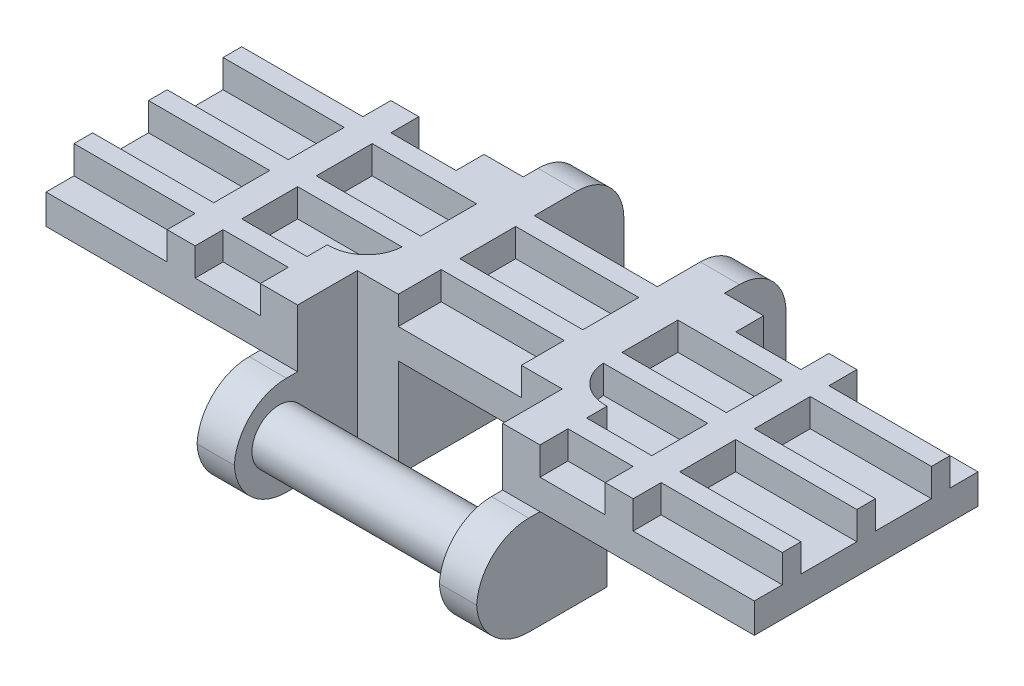
from build123d import *

# Parameters (mm, degrees)
SKETCH_1_W               = 38
SKETCH_1_H               = 12
EXTRUDE_1_DEPTH          = 1.6
EXTRUDE_START            = 1.6
SKETCH_1_3_W             = 38
SKETCH_1_3_H             = 1
SKETCH_1_3_W_2           = 1.5
SKETCH_1_3_H_2           = 12
EXTRUDE_2_DEPTH          = 1.5
EXTRUDE_START_2          = 3.1
EXTRUDE_3_DEPTH          = 8.4
SKETCH_2_4_W             = 2.1
SKETCH_2_4_H             = 1.5
EXTRUDE_5_DEPTH          = 3.1
CUT_EXTRUDE_1_DEPTH      = 22.850629282
FILLET_1_R               = 3
EXTRUDE_4_REACH          = 28.771
SKETCH_3_R               = 1.45
CUT_EXTRUDE_2_DEPTH      = 27.771253239
CUT_EXTRUDE_2_DEPTH_BACK = 27.771253239
SKETCH_3_3_R             = 1.7
SKETCH_3_3_W             = 6.5
SKETCH_3_3_H             = 1.2
SKETCH_3_3_W_2           = 3.4
SKETCH_3_3_H_2           = 3.1
FILLET_2_R               = 2.8
FILLET_3_R               = 2.5
FILLET_4_R               = 1
FILLET_5_R               = 0.3
FILLET_6_R               = 2


with BuildPart() as part:
    # 草图1 → 凸台-拉伸1 (new body)
    with BuildSketch(Plane(origin=(0, 0, 0), x_dir=(1, 0, 0), z_dir=(0, 1, 0))):
        Rectangle(SKETCH_1_W, SKETCH_1_H)
    extrude(amount=EXTRUDE_1_DEPTH)

    # 草图1<3> → 凸台-拉伸2 (add)
    with BuildSketch(Plane(origin=(0, 0, 0), x_dir=(1, 0, 0), z_dir=(0, 1, 0)).offset(EXTRUDE_START)):
        with Locations((0, 4)):
            Rectangle(SKETCH_1_3_W, SKETCH_1_3_H)
        Rectangle(SKETCH_1_3_W, SKETCH_1_3_H)
        with Locations((0, -4)):
            Rectangle(SKETCH_1_3_W, SKETCH_1_3_H)
        with Locations((-11.75, 0)):
            Rectangle(SKETCH_1_3_W_2, SKETCH_1_3_H_2)
        with Locations((11.75, 0)):
            Rectangle(SKETCH_1_3_W_2, SKETCH_1_3_H_2)
    extrude(amount=EXTRUDE_2_DEPTH)

    # 草图2 → 凸台-拉伸3 (add)
    with BuildSketch(Plane(origin=(0, 0, 0), x_dir=(1, 0, 0), z_dir=(0, 1, 0)).offset(EXTRUDE_START_2)):
        Polygon((-3.3, 9.3), (-5.4, 9.3), (-5.4, -2.4), (-7.5, -2.4), (-7.5, -9.4), (-5.5, -9.4), (-5.5, -2.8), (-3.3, -2.8), align=None)
        Polygon((5.4, 9.3), (3.3, 9.3), (3.3, -2.8), (5.5, -2.8), (5.5, -9.4), (7.5, -9.4), (7.5, -2.4), (5.4, -2.4), align=None)
    extrude(amount=-EXTRUDE_3_DEPTH)

    # 草图2<4> → 凸台-拉伸5 (add)
    with BuildSketch(Plane(origin=(0, 0, 0), x_dir=(1, 0, 0), z_dir=(0, 1, 0))):
        with Locations((-6.45, 5.25)):
            Rectangle(SKETCH_2_4_W, SKETCH_2_4_H)
        with Locations((6.45, 5.25)):
            Rectangle(SKETCH_2_4_W, SKETCH_2_4_H)
    extrude(amount=EXTRUDE_5_DEPTH)

    # 草图2<3> → 切除-拉伸1 (cut, through all)
    with BuildSketch(Plane(origin=(0, 0, 0), x_dir=(1, 0, 0), z_dir=(0, 1, 0))):
        Polygon((0, -9.4), (0, -2.8), (-3.3, -2.8), (-5.4, -2.8), (-5.5, -2.8), (-5.5, -9.4), align=None)
        Polygon((3.3, -2.8), (0, -2.8), (0, -9.4), (5.5, -9.4), (5.5, -2.8), (5.4, -2.8), align=None)
    extrude(amount=CUT_EXTRUDE_1_DEPTH, mode=Mode.SUBTRACT)

    # 圆角1
    # the kernel refuses this fillet: 3 mm, written as the material it adds along each edge
    with BuildSketch(Plane(origin=(5.4, 7.154544011, 2.4), x_dir=(1, 0, 0), z_dir=(0, -1, 0))) as fillet_1_piece_1_section:
        with BuildLine():
            CenterArc((3, -2.861817604), FILLET_1_R, 107.457603124, 72.542396876)
            Line((0, -2.861817604), (0, 0))
            Line((0, 0), (2.1, 0))
        make_face()
    fillet_1_piece_1 = extrude(amount=12.454544011, mode=Mode.PRIVATE)
    fillet_1_piece_1 = split(fillet_1_piece_1, bisect_by=Plane(origin=(6.297598678, 1.6, 1.686657362), z_dir=(0, -1, 0)), keep=Keep.TOP, mode=Mode.PRIVATE)
    add(fillet_1_piece_1)
    with BuildSketch(Plane(origin=(-5.4, 0, 2.4), x_dir=(0, 0, -1), z_dir=(0, -1, 0))) as fillet_1_piece_2:
        with BuildLine():
            CenterArc((2.861817604, -3), FILLET_1_R, 90, 72.542396876)
            Line((0, -2.1), (0, 0))
            Line((0, 0), (2.861817604, 0))
        make_face()
    extrude(amount=5.3)

    # 草图3 → 凸台-拉伸4 (add, up to next)
    with BuildSketch(Plane(origin=(-5.5, 0, 0), x_dir=(0, 0, -1), z_dir=(1, 0, 0)), mode=Mode.PRIVATE) as extrude_4_sk1:
        with Locations((-7, -2.5)):
            Circle(SKETCH_3_R)
    extrude_4_tool1 = extrude(extrude_4_sk1.sketch, amount=EXTRUDE_4_REACH, mode=Mode.PRIVATE) - part.part
    add(extrude_4_tool1.solids().sort_by_distance((-5.5, -2.5, 7))[0])

    # 草图3<3> → 切除-拉伸2 (cut, two sides: drawn at the far end of the back side and taken through both)
    with BuildSketch(Plane(origin=(-5.5, 0, 0), x_dir=(0, 0, -1), z_dir=(1, 0, 0)).offset(-CUT_EXTRUDE_2_DEPTH_BACK)):
        with Locations((5.58, -2.5)):
            Circle(SKETCH_3_3_R)
        with Locations((6.05, -4.7)):
            Rectangle(SKETCH_3_3_W, SKETCH_3_3_H)
        with Locations((-7.7, 1.55)):
            Rectangle(SKETCH_3_3_W_2, SKETCH_3_3_H_2)
    extrude(amount=CUT_EXTRUDE_2_DEPTH + CUT_EXTRUDE_2_DEPTH_BACK, mode=Mode.SUBTRACT)

    # 圆角2
    # the kernel refuses this fillet: 2.8 mm, written as the material it takes off along each edge
    with BuildSketch(Plane(origin=(-1.5, 0, 9.4), x_dir=(0, 0, -1), z_dir=(1, 0, 0)), Plane(origin=(-14.5, 0, 9.4), x_dir=(0, 0, -1), z_dir=(1, 0, 0))) as fillet_2_piece_1:
        with BuildLine():
            CenterArc((FILLET_2_R, -FILLET_2_R), FILLET_2_R, 90, 90)
            Line((0, -FILLET_2_R), (0, 0))
            Line((0, 0), (FILLET_2_R, 0))
        make_face()
    extrude(amount=16, mode=Mode.SUBTRACT)
    with BuildSketch(Plane(origin=(-1.5, -5.3, 9.4), x_dir=(0, 0, -1), z_dir=(1, 0, 0)), Plane(origin=(-14.5, -5.3, 9.4), x_dir=(0, 0, -1), z_dir=(1, 0, 0))) as fillet_2_piece_2:
        with BuildLine():
            CenterArc((FILLET_2_R, FILLET_2_R), FILLET_2_R, 180, 90)
            Line((0, FILLET_2_R), (0, 0))
            Line((0, 0), (FILLET_2_R, 0))
        make_face()
    extrude(amount=16, mode=Mode.SUBTRACT)

    # 圆角3
    fillet_3_edges = [part.edges().sort_by_distance(p)[0] for p in [
        (-4.35, 3.1, -9.3),
        (4.35, 3.1, -9.3),
    ]]
    fillet(fillet_3_edges, radius=FILLET_3_R)

    # 圆角4
    fillet_4_edges = [part.edges().sort_by_distance(p)[0] for p in [
        (-4.35, -4.1, -9.3),
        (4.35, -4.1, -9.3),
    ]]
    fillet(fillet_4_edges, radius=FILLET_4_R)

    # 圆角5
    fillet_5_edges = [part.edges().sort_by_distance(p)[0] for p in [
        (-4.35, -4.1, -5.005543735),
        (4.35, -4.1, -5.005543735),
        (-4.35, -4.1, -6.154456265),
        (4.35, -4.1, -6.154456265),
    ]]
    fillet(fillet_5_edges, radius=FILLET_5_R)

    # 圆角6
    # the kernel refuses this fillet: 2 mm, written as the material it adds along each edge
    with BuildSketch(Plane(origin=(5.4, 3.1, 2.4), x_dir=(0, 0, -1), z_dir=(0, -1, 0))) as fillet_6_piece_1:
        with BuildLine():
            CenterArc((2, 1.997498436), FILLET_6_R, 180, 87.134016017)
            Line((0, 1.997498436), (-0.04, 1.997498436))
            Line((-0.04, 1.997498436), (-0.04, 0))
            Line((-0.04, 0), (0, -0.04))
            ThreePointArc((0, -0.04), (0.95, -0.04), (1.898, -0.039949969))
            Line((1.898, -0.039949969), (1.9, 0))
        make_face()
    extrude(amount=6.493746089)
    with BuildSketch(Plane(origin=(-5.4, 3.1, 2.4), x_dir=(-1, 0, 0), z_dir=(0, -1, 0))) as fillet_6_piece_2:
        with BuildLine():
            CenterArc((1.997498436, 2), FILLET_6_R, 182.865983983, 87.134016017)
            Line((0, 1.9), (-0.039949969, 1.898))
            ThreePointArc((-0.039949969, 1.898), (-0.04, 0.95), (-0.04, 0))
            Line((-0.04, 0), (0, -0.04))
            Line((0, -0.04), (1.997498436, -0.04))
            Line((1.997498436, -0.04), (1.997498436, 0))
        make_face()
    extrude(amount=6.493746089)


solid = part.part
